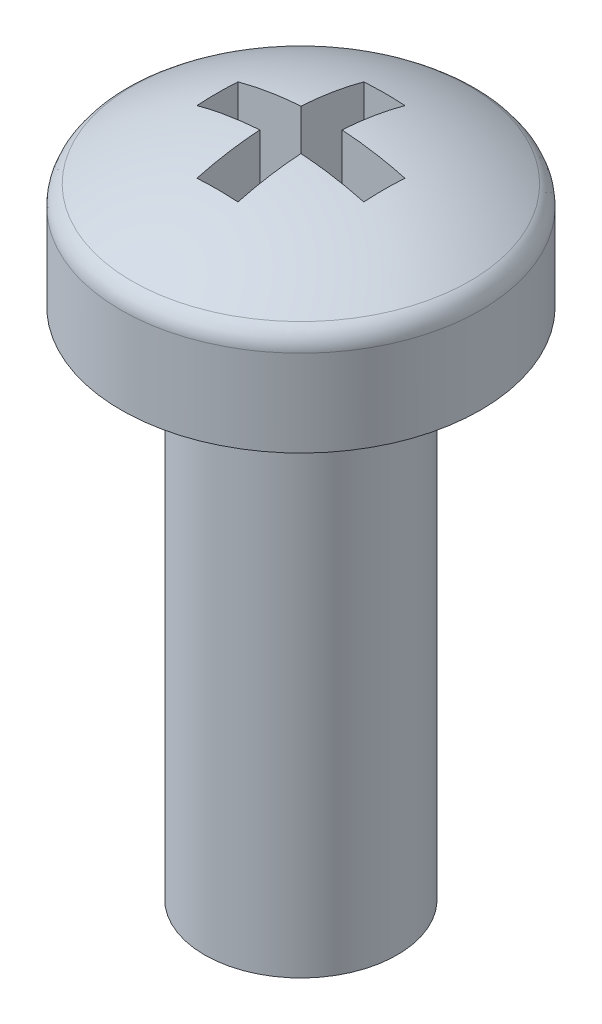
from build123d import *

# Parameters (mm, degrees)
SKETCH2_R           = 1.5
BOSS_EXTRUDE2_DEPTH = 8
CUT_EXTRUDE1_REACH  = 11.504
FILLET1_R           = 0.36


with BuildPart() as part:
    # Boss-Extrude1: read off the stored shape, not the designer's step
    # Boss-Extrude1 outline → Boss-Extrude1 (revolve)
    with BuildSketch(Plane.XY):
        with BuildLine():
            Line((2.8, 0), (2.8, 1.542463035))
            ThreePointArc((2.8, 1.542463035), (1.464186604, 2.180811394), (0, 2.4))
            Line((0, 2.4), (0, 0))
            Line((0, 0), (2.8, 0))
        make_face()
    revolve(axis=Axis((0, 0, 0), (0, 1, 0)))

    # Sketch2 → Boss-Extrude2 (add)
    with BuildSketch(Plane.XZ):
        with Locations(Location((0, 0, 0), (0, 0, 270))):
            Circle(SKETCH2_R)
    extrude(amount=BOSS_EXTRUDE2_DEPTH)

    # Sketch3 → Cut-Extrude1 (cut, up to next)
    with BuildSketch(Plane.XZ.offset(-0.64), mode=Mode.PRIVATE) as cut_extrude1_sk1:
        Polygon((-0.32, -1.3), (0.32, -1.3), (0.32, -0.32), (1.3, -0.32), (1.3, 0.32), (0.32, 0.32), (0.32, 1.3), (-0.32, 1.3), (-0.32, 0.32), (-1.3, 0.32), (-1.3, -0.32), (-0.32, -0.32), align=None)
    cut_extrude1_tool1 = extrude(cut_extrude1_sk1.sketch, amount=-CUT_EXTRUDE1_REACH, mode=Mode.PRIVATE) & part.part
    add(cut_extrude1_tool1.solids().sort_by_distance((0, 0.64, 0))[0], mode=Mode.SUBTRACT)

    # Fillet1
    fillet1_edges = [part.edges().sort_by_distance(p)[0] for p in [
        (-2.8, 1.542463035, 0),
    ]]
    fillet(fillet1_edges, radius=FILLET1_R)


solid = part.part
